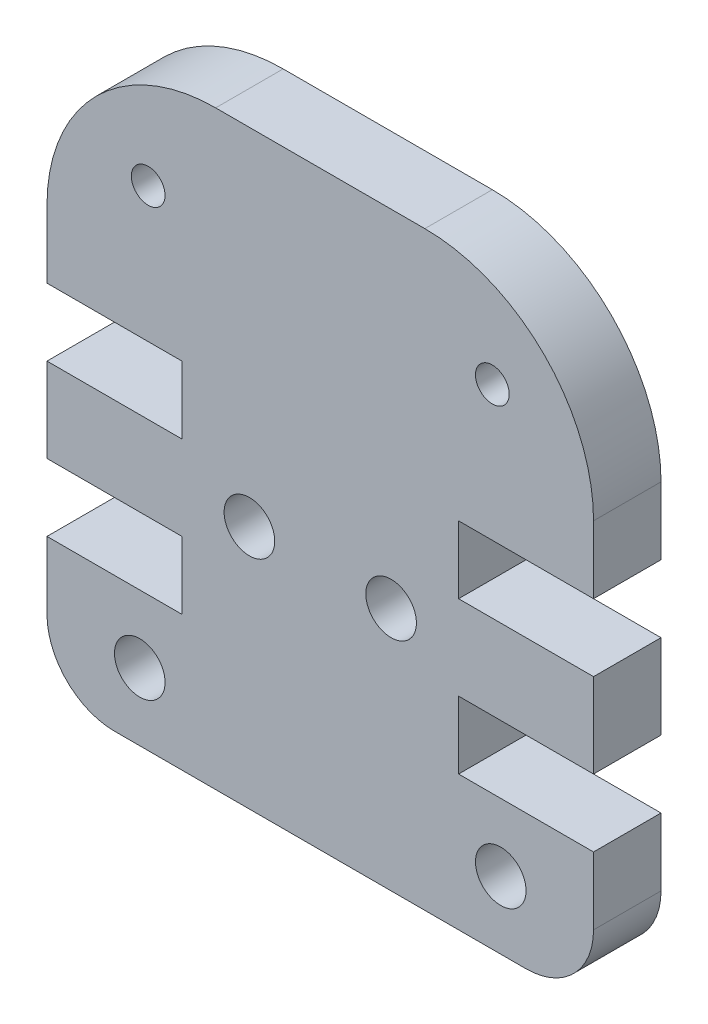
from build123d import *

# Parameters (mm, degrees)
SKETCH1_R           = 0.75
SKETCH1_R_2         = 0.5
BOSS_EXTRUDE1_DEPTH = 2


with BuildPart() as part:
    # Sketch1 → Boss-Extrude1 (new body)
    with BuildSketch(Plane.XY):
        with BuildLine():
            Line((0, 12.5), (0, 10.5))
            Line((0, 10.5), (4, 10.5))
            Line((4, 10.5), (4, 8.5))
            Line((4, 8.5), (0, 8.5))
            Line((0, 8.5), (0, 6))
            Line((0, 6), (4, 6))
            Line((4, 6), (4, 4))
            Line((4, 4), (0, 4))
            Line((0, 4), (0, 2))
            ThreePointArc((0, 2), (0.585786438, 0.585786438), (2, 0))
            Line((2, 0), (14.2, 0))
            ThreePointArc((14.2, 0), (15.614213562, 0.585786438), (16.2, 2))
            Line((16.2, 2), (16.2, 4))
            Line((16.2, 4), (12.2, 4))
            Line((12.2, 4), (12.2, 6))
            Line((12.2, 6), (16.2, 6))
            Line((16.2, 6), (16.2, 8.5))
            Line((16.2, 8.5), (12.2, 8.5))
            Line((12.2, 8.5), (12.2, 10.5))
            Line((12.2, 10.5), (16.2, 10.5))
            Line((16.2, 10.5), (16.2, 12.5))
            ThreePointArc((16.2, 12.5), (14.735533906, 16.035533906), (11.2, 17.5))
            Line((11.2, 17.5), (5, 17.5))
            ThreePointArc((5, 17.5), (1.464466094, 16.035533906), (0, 12.5))
        make_face()
        with Locations((10.2, 7.25)):
            Circle(SKETCH1_R, mode=Mode.SUBTRACT)
        with Locations((6, 7.25)):
            Circle(SKETCH1_R, mode=Mode.SUBTRACT)
        with Locations((3, 14.5)):
            Circle(SKETCH1_R_2, mode=Mode.SUBTRACT)
        with Locations((13.2, 14.5)):
            Circle(SKETCH1_R_2, mode=Mode.SUBTRACT)
        with Locations((13.45, 2)):
            Circle(SKETCH1_R, mode=Mode.SUBTRACT)
        with Locations((2.75, 2)):
            Circle(SKETCH1_R, mode=Mode.SUBTRACT)
    extrude(amount=BOSS_EXTRUDE1_DEPTH)


solid = part.part
